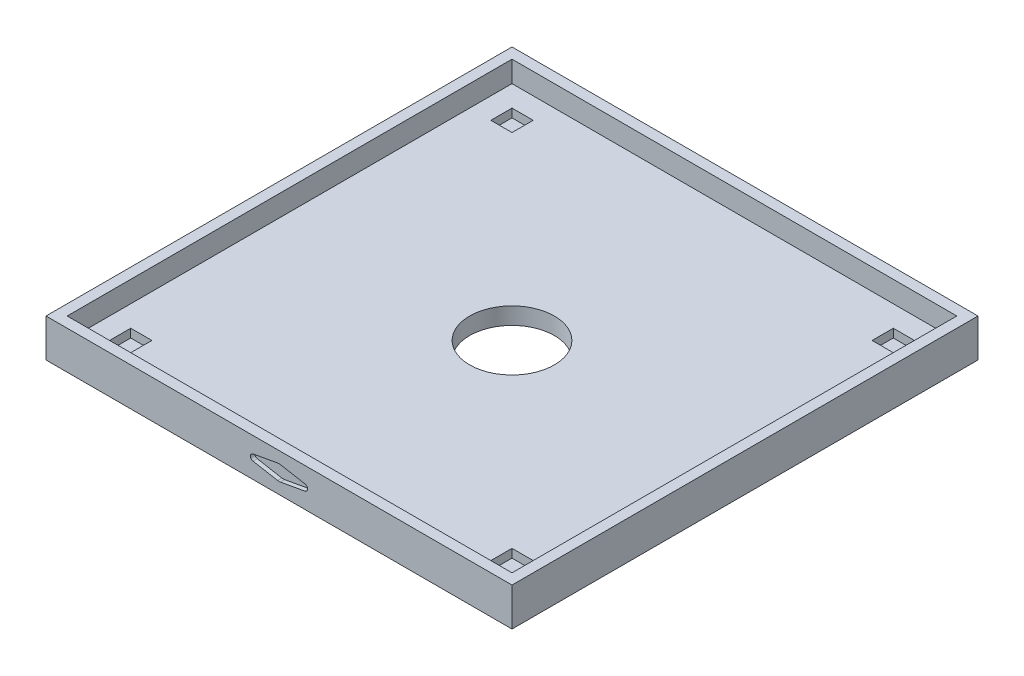
from build123d import *

# Parameters (mm, degrees)
SKETCH1_W                                  = 220
SKETCH1_H                                  = 220
BOSS_EXTRUDE1_DEPTH                        = 18
SKETCH2_W                                  = 210
SKETCH2_H                                  = 210
CUT_EXTRUDE1_DEPTH                         = 10
CUT_EXTRUDE2_DEPTH                         = 2
SKETCH4_W                                  = 10
SKETCH4_H                                  = 10
CUT_EXTRUDE3_DEPTH                         = 4
MIRROR2_AT_THE_SECOND_PLANE_COPY_1_SKETC_W = 10
MIRROR2_AT_THE_SECOND_PLANE_COPY_1_SKETC_H = 10
MIRROR2_AT_THE_SECOND_PLANE_COPY_1_DEPTH   = 4
SKETCH5_R                                  = 20
CUT_EXTRUDE4_DEPTH                         = 156.884572681


with BuildPart() as part:
    # Sketch1 → Boss-Extrude1 (new body)
    with BuildSketch(Plane(origin=(0, 0, 0), x_dir=(1, 0, 0), z_dir=(0, 1, 0))):
        Rectangle(SKETCH1_W, SKETCH1_H)
    extrude(amount=BOSS_EXTRUDE1_DEPTH)

    # Sketch2 → Cut-Extrude1 (cut)
    with BuildSketch(Plane(origin=(0, 18, 0), x_dir=(1, 0, 0), z_dir=(0, 1, 0))):
        Rectangle(SKETCH2_W, SKETCH2_H)
    extrude(amount=-CUT_EXTRUDE1_DEPTH, mode=Mode.SUBTRACT)

    # Sketch3 → Cut-Extrude2 (cut)
    with BuildSketch(Plane.XY.offset(110)):
        with BuildLine():
            Line((-12.26625, 10.476181201), (-0.644325, 12.572358506))
            ThreePointArc((-0.644325, 12.572358506), (0, 12.63), (0.644325, 12.572358506))
            Line((0.644325, 12.572358506), (12.26625, 10.476181201))
            ThreePointArc((12.26625, 10.476181201), (13.5, 9), (12.26625, 7.523818799))
            Line((12.26625, 7.523818799), (0.644325, 5.427641494))
            ThreePointArc((0.644325, 5.427641494), (0, 5.37), (-0.644325, 5.427641494))
            Line((-0.644325, 5.427641494), (-12.26625, 7.523818799))
            ThreePointArc((-12.26625, 7.523818799), (-13.5, 9), (-12.26625, 10.476181201))
        make_face()
    cut_extrude2 = extrude(amount=-CUT_EXTRUDE2_DEPTH, mode=Mode.SUBTRACT)

    # Mirror1: Cut-Extrude2 across plane
    add(cut_extrude2.mirror(Plane.XY), mode=Mode.SUBTRACT)

    # Sketch4 → Cut-Extrude3 (cut)
    with BuildSketch(Plane(origin=(0, 8, 0), x_dir=(1, 0, 0), z_dir=(0, 1, 0))):
        with Locations((-90, 90)):
            Rectangle(SKETCH4_W, SKETCH4_H)
    cut_extrude3 = extrude(amount=-CUT_EXTRUDE3_DEPTH, mode=Mode.SUBTRACT)

    # Mirror2: Cut-Extrude3 across plane
    add(cut_extrude3.mirror(Plane(origin=(0, 0, 0), x_dir=(0, 0, 1), z_dir=(1, 0, 0))), mode=Mode.SUBTRACT)

    # Mirror2 at the second plane: Cut-Extrude3 across plane
    add(cut_extrude3.mirror(Plane.XY), mode=Mode.SUBTRACT)

    # Mirror2 at the second plane copy 1 sketc → Mirror2 at the second plane copy 1 (cut)
    with BuildSketch(Plane(origin=(0, 8, 0), x_dir=(-1, 0, 0), z_dir=(0, 1, 0))):
        with Locations((-90, 90)):
            Rectangle(MIRROR2_AT_THE_SECOND_PLANE_COPY_1_SKETC_W, MIRROR2_AT_THE_SECOND_PLANE_COPY_1_SKETC_H)
    extrude(amount=-MIRROR2_AT_THE_SECOND_PLANE_COPY_1_DEPTH, mode=Mode.SUBTRACT)

    # Sketch5 → Cut-Extrude4 (cut, through all)
    with BuildSketch(Plane(origin=(0, 8, 0), x_dir=(1, 0, 0), z_dir=(0, 1, 0))):
        Circle(SKETCH5_R)
    extrude(amount=-CUT_EXTRUDE4_DEPTH, mode=Mode.SUBTRACT)


solid = part.part
